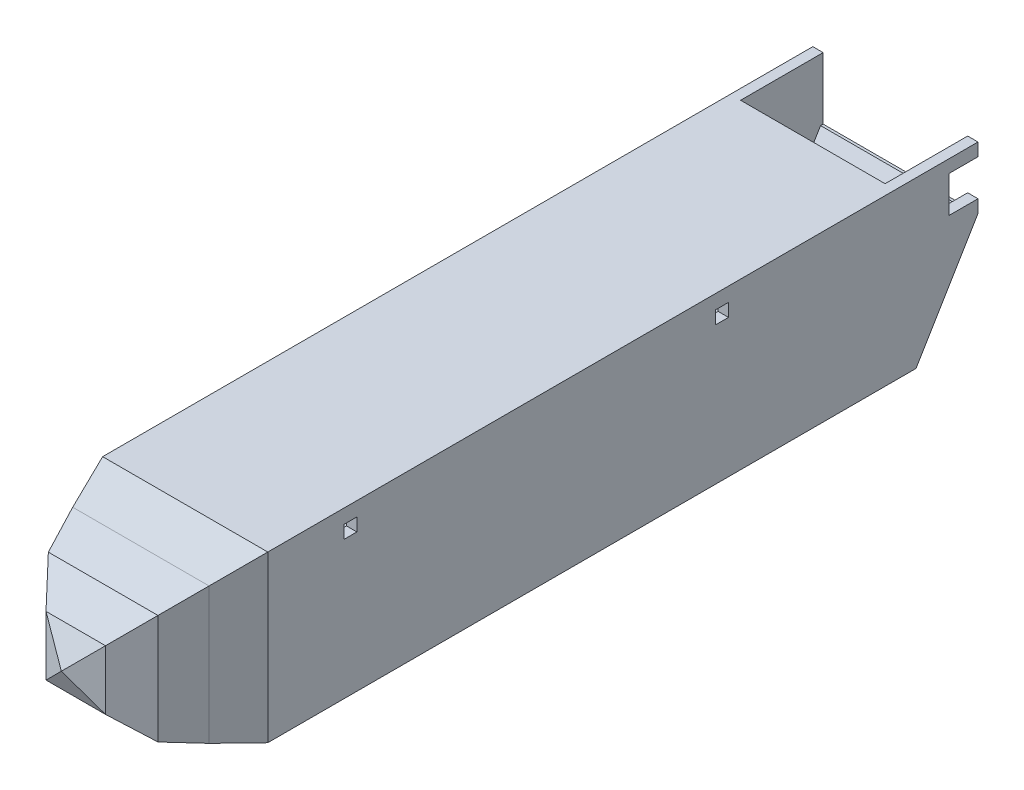
from build123d import *

# Parameters (mm, degrees)
SKETCH1_W           = 101.6
SKETCH1_H           = 101.6
BOSS_EXTRUDE1_DEPTH = 436.88
SHELL1_T            = -6.35
SKETCH9_W           = 8.001
SKETCH9_H           = 8.001
CUT_EXTRUDE1_DEPTH  = 526.503840631
CUT_EXTRUDE2_DEPTH  = 526.503840631
BOSS_EXTRUDE2_DEPTH = 101.6
SKETCH12_W          = 88.9
SKETCH12_H          = 38.1
CUT_EXTRUDE3_DEPTH  = 50.8
CUT_EXTRUDE5_REACH  = 527.504
SKETCH15_W          = 17.78
SKETCH15_H          = 22.352


with BuildPart() as part:
    # Sketch1 → Boss-Extrude1 (new body)
    with BuildSketch(Plane.XY):
        Rectangle(SKETCH1_W, SKETCH1_H)
    extrude(amount=BOSS_EXTRUDE1_DEPTH)

    # Sketch5 → Loft2 section 0
    with BuildSketch(Plane.XY.offset(436.88)):
        with BuildLine():
            Line((50.8, -50.8), (50.8, 50.8))
            Line((50.8, 50.8), (-50.8, 50.8))
            Line((-50.8, 50.8), (-50.8, -50.8))
            Line((-50.8, -50.8), (50.8, -50.8))
        make_face()
    # Sketch3 → Loft2 section 1
    with BuildSketch(Plane.XY.offset(464.156588322)):
        with BuildLine():
            Line((-41.937305, -41.937305), (41.937305, -41.937305))
            Line((41.937305, -41.937305), (41.937305, 41.937305))
            Line((41.937305, 41.937305), (-41.937305, 41.937305))
            Line((-41.937305, 41.937305), (-41.937305, -41.937305))
        make_face()
    loft()

    # Sketch3<6> → Loft3 section 0
    with BuildSketch(Plane.XY.offset(464.156588322)):
        with BuildLine():
            Line((-41.937305, -41.937305), (41.937305, -41.937305))
            Line((41.937305, -41.937305), (41.937305, 41.937305))
            Line((41.937305, 41.937305), (-41.937305, 41.937305))
            Line((-41.937305, 41.937305), (-41.937305, -41.937305))
        make_face()
    # Sketch6 → Loft3 section 1
    with BuildSketch(Plane.XY.offset(487.359440316)):
        with BuildLine():
            Line((-33.71596, -33.71596), (33.71596, -33.71596))
            Line((33.71596, -33.71596), (33.71596, 33.71596))
            Line((33.71596, 33.71596), (-33.71596, 33.71596))
            Line((-33.71596, 33.71596), (-33.71596, -33.71596))
        make_face()
    loft()

    # Sketch6<4> → Loft4 section 0
    with BuildSketch(Plane.XY.offset(487.359440316)):
        with BuildLine():
            Line((-33.71596, -33.71596), (33.71596, -33.71596))
            Line((33.71596, -33.71596), (33.71596, 33.71596))
            Line((33.71596, 33.71596), (-33.71596, 33.71596))
            Line((-33.71596, 33.71596), (-33.71596, -33.71596))
        make_face()
    # Sketch7 → Loft4 section 1
    with BuildSketch(Plane.XY.offset(504.217299158)):
        with BuildLine():
            Line((-18.304143458, -18.304143458), (18.304143458, -18.304143458))
            Line((18.304143458, -18.304143458), (18.304143458, 18.304143458))
            Line((18.304143458, 18.304143458), (-18.304143458, 18.304143458))
            Line((-18.304143458, 18.304143458), (-18.304143458, -18.304143458))
        make_face()
    loft()

    # Sketch7<5> → Loft5 section 0
    with BuildSketch(Plane.XY.offset(504.217299158), mode=Mode.PRIVATE) as loft5_s0:
        with BuildLine():
            Line((-18.304143458, -18.304143458), (18.304143458, -18.304143458))
            Line((18.304143458, -18.304143458), (18.304143458, 18.304143458))
            Line((18.304143458, 18.304143458), (-18.304143458, 18.304143458))
            Line((-18.304143458, 18.304143458), (-18.304143458, -18.304143458))
        make_face()
    loft([Vertex(0, 0, 513.079999985), loft5_s0.sketch])

    # Shell1
    shell1_openings = [part.faces().sort_by_distance(p)[0] for p in [
        (0, 0, 0),
    ]]
    offset(amount=SHELL1_T, openings=shell1_openings, kind=Kind.INTERSECTION)

    # Sketch9 → Cut-Extrude1 (cut, through all)
    with BuildSketch(Plane(origin=(50.8, 0, 0), x_dir=(0, 0, -1), z_dir=(1, 0, 0))):
        with Locations((-386.08, 38.1)):
            Rectangle(SKETCH9_W, SKETCH9_H)
        Polygon((-161.4805, 42.1005), (-161.4805, 38.1), (-161.4805, 34.0995), (-153.4795, 34.0995), (-153.4795, 42.1005), align=None)
    extrude(amount=-CUT_EXTRUDE1_DEPTH, mode=Mode.SUBTRACT)

    # Sketch10 → Cut-Extrude2 (cut, through all)
    with BuildSketch(Plane(origin=(50.8, 0, 0), x_dir=(0, 0, -1), z_dir=(1, 0, 0))):
        Polygon((0, -50.8), (0, 12.7), (-38.1, -50.8), align=None)
    extrude(amount=-CUT_EXTRUDE2_DEPTH, mode=Mode.SUBTRACT)

    # Sketch11 → Boss-Extrude2 (add)
    with BuildSketch(Plane(origin=(50.8, 0, 0), x_dir=(0, 0, -1), z_dir=(1, 0, 0))):
        Polygon((-38.1, -50.8), (-39.6875, -50.8), (-1.5875, 12.7), (-1.5875, 50.8), (0, 50.8), (0, 12.7), align=None)
    extrude(amount=-BOSS_EXTRUDE2_DEPTH)

    # Sketch12 → Cut-Extrude3 (cut)
    with BuildSketch(Plane(origin=(0, 0, 0), x_dir=(-1, 0, 0), z_dir=(0, 0, -1))):
        with Locations((0, 31.75)):
            Rectangle(SKETCH12_W, SKETCH12_H)
    extrude(amount=-CUT_EXTRUDE3_DEPTH, mode=Mode.SUBTRACT)

    # Sketch15 → Cut-Extrude5 (cut, up to next)
    with BuildSketch(Plane(origin=(50.8, 0, 0), x_dir=(0, 0, -1), z_dir=(1, 0, 0)), mode=Mode.PRIVATE) as cut_extrude5_sk1:
        with Locations((-8.89, 31.75)):
            Rectangle(SKETCH15_W, SKETCH15_H)
    cut_extrude5_tool1 = extrude(cut_extrude5_sk1.sketch, amount=-CUT_EXTRUDE5_REACH, mode=Mode.PRIVATE) & part.part
    add(cut_extrude5_tool1.solids().sort_by_distance((50.8, 31.75, 8.89))[0], mode=Mode.SUBTRACT)


solid = part.part
